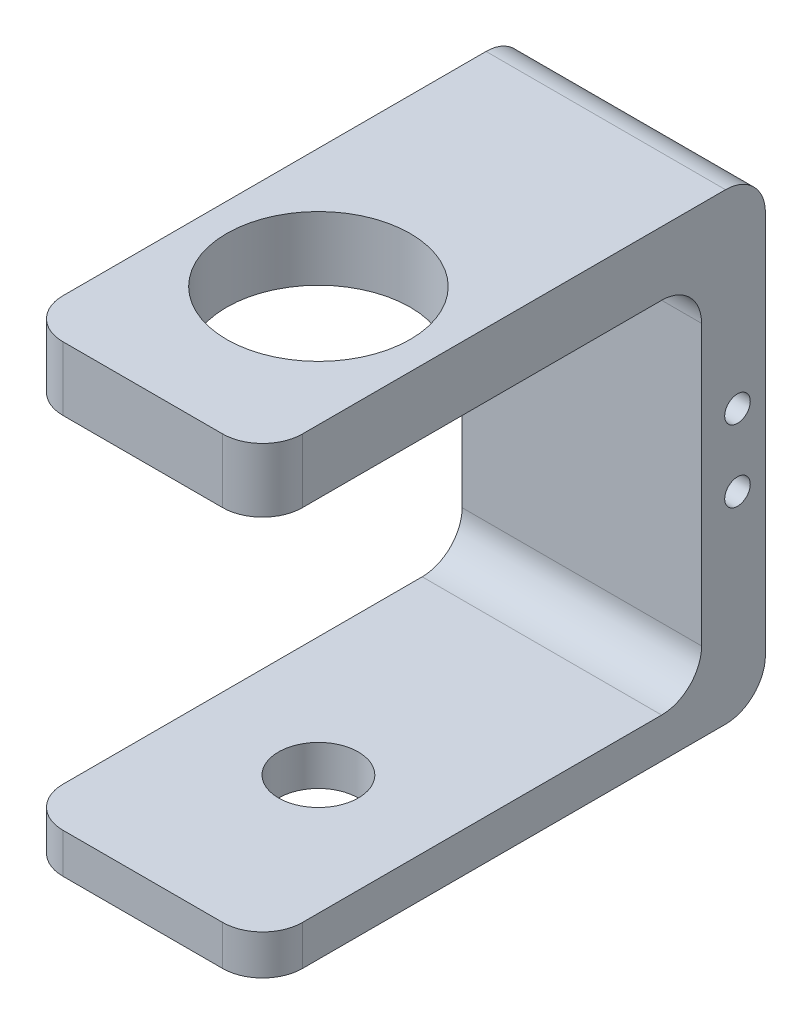
from build123d import *

# Parameters (mm, degrees)
BOSS_EXTRUDE1_DEPTH = 30
CUT_EXTRUDE1_REACH  = 92.736
SKETCH2_R           = 11.5
CUT_EXTRUDE2_REACH  = 89.624
SKETCH3_R           = 5
CUT_EXTRUDE3_REACH  = 87.843
SKETCH4_R           = 1.6
FILLET1_R           = 5
FILLET2_R           = 5


with BuildPart() as part:
    # Sketch1 → Boss-Extrude1 (new body)
    with BuildSketch(Plane(origin=(0, 0, 0), x_dir=(0, 0, -1), z_dir=(1, 0, 0))):
        Polygon((0, 0), (55, 0), (55, -45), (0, -45), (0, -50), (63, -50), (63, 8), (0, 8), align=None)
    extrude(amount=BOSS_EXTRUDE1_DEPTH)

    # Sketch2 → Cut-Extrude1 (cut, up to next)
    with BuildSketch(Plane(origin=(0, 8, 0), x_dir=(1, 0, 0), z_dir=(0, 1, 0)), mode=Mode.PRIVATE) as cut_extrude1_sk1:
        with Locations((15, 22)):
            Circle(SKETCH2_R)
    cut_extrude1_tool1 = extrude(cut_extrude1_sk1.sketch, amount=-CUT_EXTRUDE1_REACH, mode=Mode.PRIVATE) & part.part
    add(cut_extrude1_tool1.solids().sort_by_distance((15, 8, -22))[0], mode=Mode.SUBTRACT)

    # Sketch3 → Cut-Extrude2 (cut, up to next)
    with BuildSketch(Plane(origin=(0, -45, 0), x_dir=(1, 0, 0), z_dir=(0, 1, 0)), mode=Mode.PRIVATE) as cut_extrude2_sk1:
        with Locations((15, 22)):
            Circle(SKETCH3_R)
    cut_extrude2_tool1 = extrude(cut_extrude2_sk1.sketch, amount=-CUT_EXTRUDE2_REACH, mode=Mode.PRIVATE) & part.part
    add(cut_extrude2_tool1.solids().sort_by_distance((15, -45, -22))[0], mode=Mode.SUBTRACT)

    # Sketch4 → Cut-Extrude3 (cut, up to next)
    with BuildSketch(Plane(origin=(30, 0, 0), x_dir=(0, 0, -1), z_dir=(1, 0, 0)), mode=Mode.PRIVATE) as cut_extrude3_sk1:
        with Locations((59.5, -25.5)):
            Circle(SKETCH4_R)
    cut_extrude3_tool1 = extrude(cut_extrude3_sk1.sketch, amount=-CUT_EXTRUDE3_REACH, mode=Mode.PRIVATE) & part.part
    # Sketch4 → Cut-Extrude3 (cut, up to next)
    with BuildSketch(Plane(origin=(30, 0, 0), x_dir=(0, 0, -1), z_dir=(1, 0, 0)), mode=Mode.PRIVATE) as cut_extrude3_sk2:
        with Locations((59.5, -16.5)):
            Circle(SKETCH4_R)
    cut_extrude3_tool2 = extrude(cut_extrude3_sk2.sketch, amount=-CUT_EXTRUDE3_REACH, mode=Mode.PRIVATE) & part.part
    add(cut_extrude3_tool1.solids().sort_by_distance((30, -25.5, -59.5))[0], mode=Mode.SUBTRACT)
    add(cut_extrude3_tool2.solids().sort_by_distance((30, -16.5, -59.5))[0], mode=Mode.SUBTRACT)

    # Fillet1
    fillet1_edges = [part.edges().sort_by_distance(p)[0] for p in [
        (15, -50, -63),
        (15, 8, -63),
        (0, -47.5, 0),
        (0, 4, 0),
        (30, -47.5, 0),
        (30, 4, 0),
    ]]
    fillet(fillet1_edges, radius=FILLET1_R)

    # Fillet2
    fillet2_edges = [part.edges().sort_by_distance(p)[0] for p in [
        (15, 0, -55),
        (15, -45, -55),
    ]]
    fillet(fillet2_edges, radius=FILLET2_R)


solid = part.part
